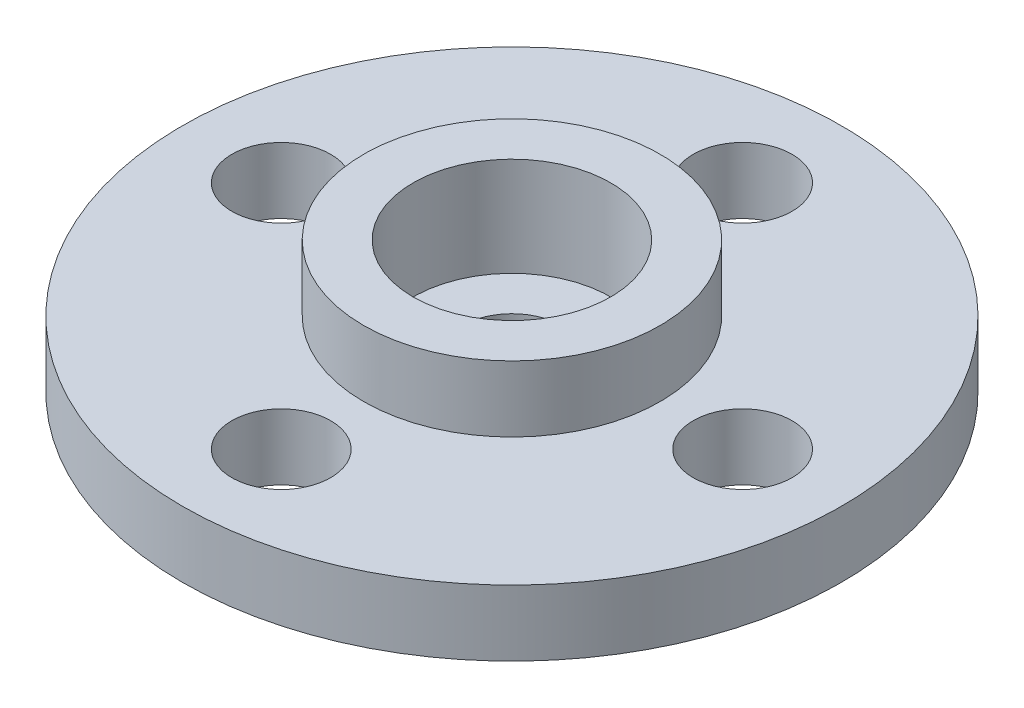
from build123d import *

# Parameters (mm, degrees)
SKETCH_1_R               = 10
EXTRUDE_351_DEPTH        = 2
SKETCH_2_R               = 4.5
EXTRUDE_436_DEPTH        = 2
SKETCH_3_R               = 3
CUT_EXTRUDE_526_DEPTH    = 3
SKETCH_4_R               = 1.5
CUT_EXTRUDE_623_DEPTH    = 15.456832295
SKETCH_5_R               = 1.5
CUT_EXTRUDE_727_DEPTH    = 15.282856857
PATTERN_CIRCULAR_1_COUNT = 4


with BuildPart() as part:
    # Эскиз1 → Extrude 351 (new body)
    with BuildSketch(Plane(origin=(0, 0, 0), x_dir=(1, 0, 0), z_dir=(0, 1, 0))):
        Circle(SKETCH_1_R)
    extrude(amount=EXTRUDE_351_DEPTH)

    # Эскиз2 → Extrude 436 (add)
    with BuildSketch(Plane(origin=(0, 2, 0), x_dir=(1, 0, 0), z_dir=(0, 1, 0))):
        Circle(SKETCH_2_R)
    extrude(amount=EXTRUDE_436_DEPTH)

    # Эскиз3 → Cut-Extrude 526 (cut)
    with BuildSketch(Plane(origin=(0, 4, 0), x_dir=(1, 0, 0), z_dir=(0, 1, 0))):
        Circle(SKETCH_3_R)
    extrude(amount=-CUT_EXTRUDE_526_DEPTH, mode=Mode.SUBTRACT)

    # Эскиз4 → Cut-Extrude 623 (cut, through all)
    with BuildSketch(Plane(origin=(0, 1, 0), x_dir=(1, 0, 0), z_dir=(0, 1, 0))):
        Circle(SKETCH_4_R)
    extrude(amount=-CUT_EXTRUDE_623_DEPTH, mode=Mode.SUBTRACT)

    # Эскиз5 → Cut-Extrude 727 (cut, through all)
    with BuildSketch(Plane(origin=(0, 2, 0), x_dir=(1, 0, 0), z_dir=(0, 1, 0))):
        with Locations((7, 0)):
            Circle(SKETCH_5_R)
    cut_extrude_727 = extrude(amount=-CUT_EXTRUDE_727_DEPTH, mode=Mode.SUBTRACT)

    # Круговой массив1: Cut-Extrude 727 ×4 about axis
    pattern_circular_1_axis = Axis((0, 1, 0), (0, 1, 0))
    for i in range(1, PATTERN_CIRCULAR_1_COUNT):
        add(cut_extrude_727.rotate(pattern_circular_1_axis, i * 360 / PATTERN_CIRCULAR_1_COUNT), mode=Mode.SUBTRACT)


solid = part.part
